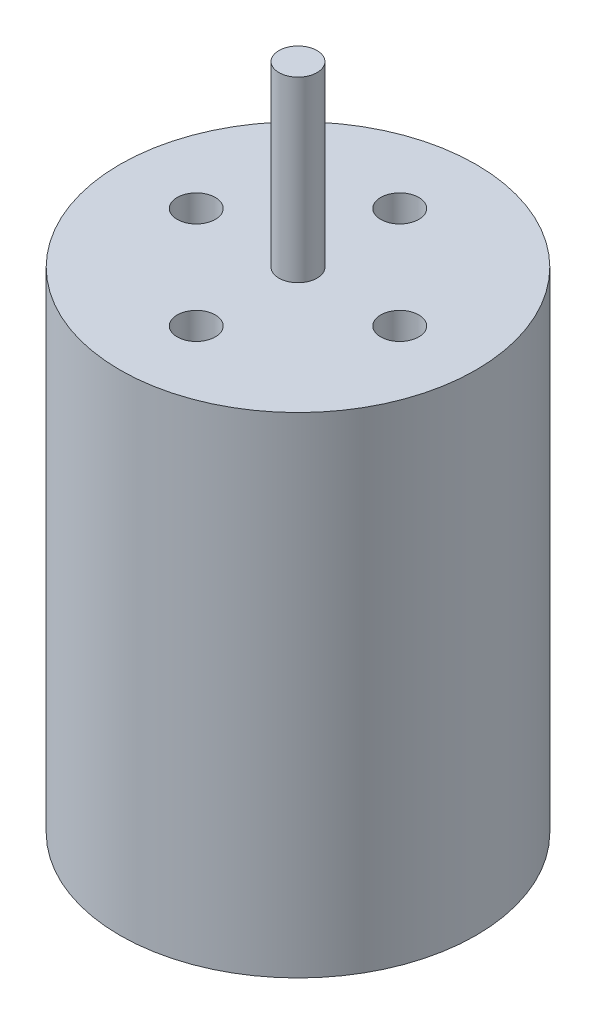
from build123d import *

# Parameters (mm, degrees)
SKETCH2_R          = 1.5
CUT_EXTRUDE1_DEPTH = 3


with BuildPart() as part:
    # Sketch1 → Revolve1 (revolve)
    with BuildSketch(Plane.XY):
        Polygon((0, -27.5), (4.4, -27.5), (4.4, -25), (14, -25), (14, 13.5), (1.5, 13.5), (1.5, 27.5), (0, 27.5), align=None)
    revolve(axis=Axis((0, -23.467413442, 0), (0, 1, 0)))

    # Sketch2 → Cut-Extrude1 (cut)
    with BuildSketch(Plane(origin=(0, 13.5, 0), x_dir=(1, 0, 0), z_dir=(0, 1, 0))):
        with Locations((-8, 0)):
            Circle(SKETCH2_R)
        with Locations((0, -8)):
            Circle(SKETCH2_R)
        with Locations((8, 0)):
            Circle(SKETCH2_R)
        with Locations((0, 8)):
            Circle(SKETCH2_R)
    extrude(amount=-CUT_EXTRUDE1_DEPTH, mode=Mode.SUBTRACT)


solid = part.part
